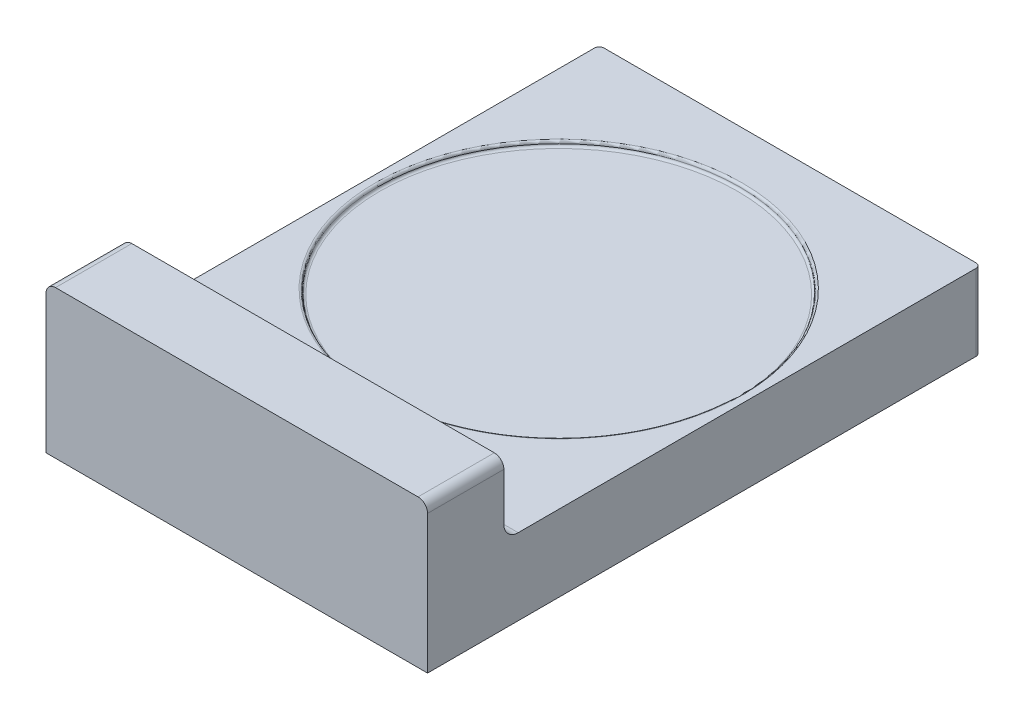
from build123d import *

# Parameters (mm, degrees)
SKETCH1_W           = 580
SKETCH1_H           = 80
BOSS_EXTRUDE1_DEPTH = 400
SKETCH2_W           = 400
SKETCH2_H           = 80
BOSS_EXTRUDE2_DEPTH = 75
FILLET2_R           = 10
FILLET3_R           = 5
FILLET4_R           = 15
SKETCH3_R           = 190
CUT_EXTRUDE1_DEPTH  = 5
FILLET6_R           = 2.5


with BuildPart() as part:
    # Sketch1 → Boss-Extrude1 (new body)
    with BuildSketch(Plane(origin=(0, 0, 0), x_dir=(0, 0, -1), z_dir=(1, 0, 0))):
        with Locations((290, 40)):
            Rectangle(SKETCH1_W, SKETCH1_H)
    extrude(amount=BOSS_EXTRUDE1_DEPTH)

    # Sketch2 → Boss-Extrude2 (add)
    with BuildSketch(Plane(origin=(0, 80, 0), x_dir=(1, 0, 0), z_dir=(0, 1, 0))):
        with Locations((200, 40)):
            Rectangle(SKETCH2_W, SKETCH2_H)
    extrude(amount=BOSS_EXTRUDE2_DEPTH)

    # Fillet2
    fillet2_edges = [part.edges().sort_by_distance(p)[0] for p in [
        (0, 155, -40),
        (400, 155, -40),
    ]]
    fillet(fillet2_edges, radius=FILLET2_R)

    # Fillet3
    fillet3_edges = [part.edges().sort_by_distance(p)[0] for p in [
        (400, 40, -580),
        (0, 40, -580),
    ]]
    fillet(fillet3_edges, radius=FILLET3_R)

    # Fillet4
    fillet4_edges = [part.edges().sort_by_distance(p)[0] for p in [
        (200, 80, -80),
    ]]
    fillet(fillet4_edges, radius=FILLET4_R)

    # Sketch3 → Cut-Extrude1 (cut)
    with BuildSketch(Plane(origin=(0, 80, 0), x_dir=(1, 0, 0), z_dir=(0, 1, 0))):
        with Locations(Location((200, 337.5, 0), (0, 0, 270))):
            Circle(SKETCH3_R)
    extrude(amount=-CUT_EXTRUDE1_DEPTH, mode=Mode.SUBTRACT)

    # Fillet6
    fillet6_edges = [part.edges().sort_by_distance(p)[0] for p in [
        (200, 75, -527.5),
        (200, 80, -527.5),
    ]]
    fillet(fillet6_edges, radius=FILLET6_R - 0.0001)  # a hair under: the kernel refuses the full size


solid = part.part
